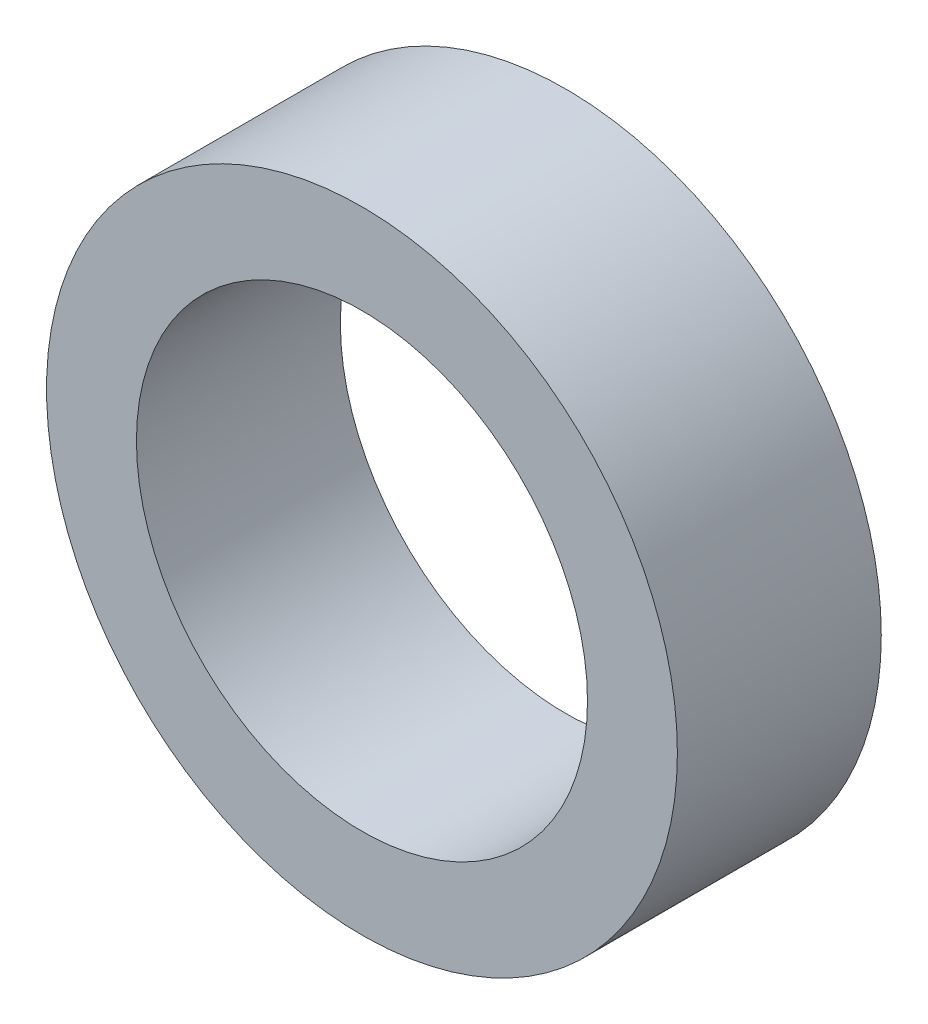
from build123d import *

# Parameters (mm, degrees)
SKETCH1_R           = 5.55625
SKETCH1_R_2         = 3.97256
BOSS_EXTRUDE1_DEPTH = 3.59156


with BuildPart() as part:
    # Sketch1 → Boss-Extrude1 (new body)
    with BuildSketch(Plane.XY):
        Circle(SKETCH1_R)
        Circle(SKETCH1_R_2, mode=Mode.SUBTRACT)
    extrude(amount=BOSS_EXTRUDE1_DEPTH)


solid = part.part
